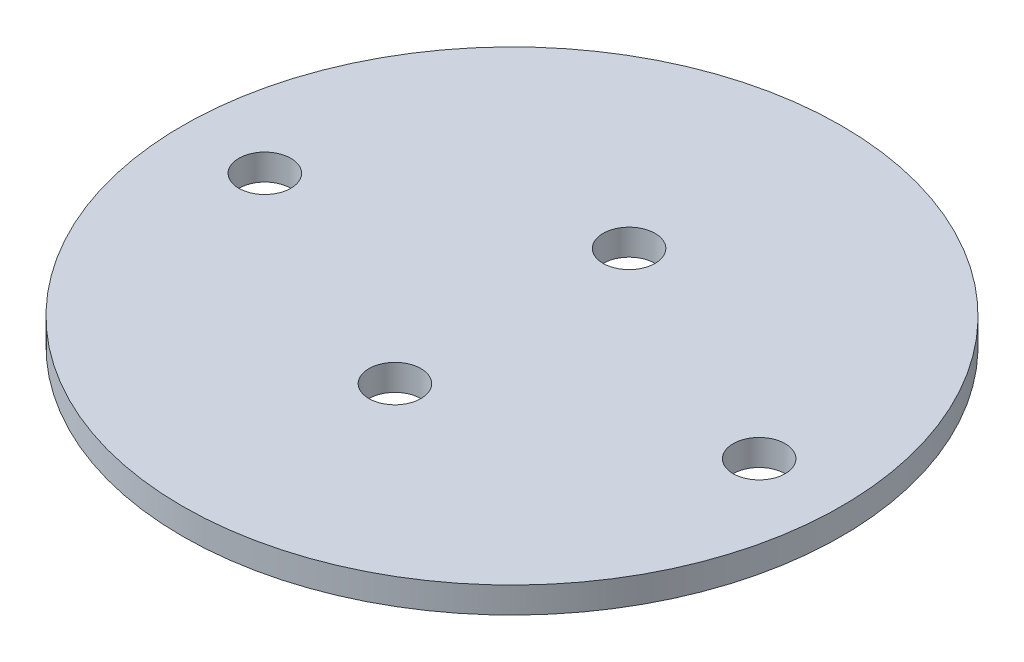
from build123d import *

# Parameters (mm, degrees)
SKETCH1_R           = 38
SKETCH1_R_2         = 3
BOSS_EXTRUDE1_DEPTH = 3


with BuildPart() as part:
    # Sketch1 → Boss-Extrude1 (new body)
    with BuildSketch(Plane(origin=(0, 0, 0), x_dir=(1, 0, 0), z_dir=(0, 1, 0))):
        Circle(SKETCH1_R)
        with BuildLine():
            ThreePointArc((3, -13.5), (-2.121320344, -15.621320344), (0, -10.5))
            ThreePointArc((0, -10.5), (2.121320344, -11.378679656), (3, -13.5))
        make_face(mode=Mode.SUBTRACT)
        with Locations((-28.5, 0)):
            Circle(SKETCH1_R_2, mode=Mode.SUBTRACT)
        with BuildLine():
            ThreePointArc((3, 13.5), (2.121320344, 11.378679656), (0, 10.5))
            ThreePointArc((0, 10.5), (-2.121320344, 15.621320344), (3, 13.5))
        make_face(mode=Mode.SUBTRACT)
        with Locations((28.5, 0)):
            Circle(SKETCH1_R_2, mode=Mode.SUBTRACT)
    extrude(amount=-BOSS_EXTRUDE1_DEPTH)


solid = part.part
